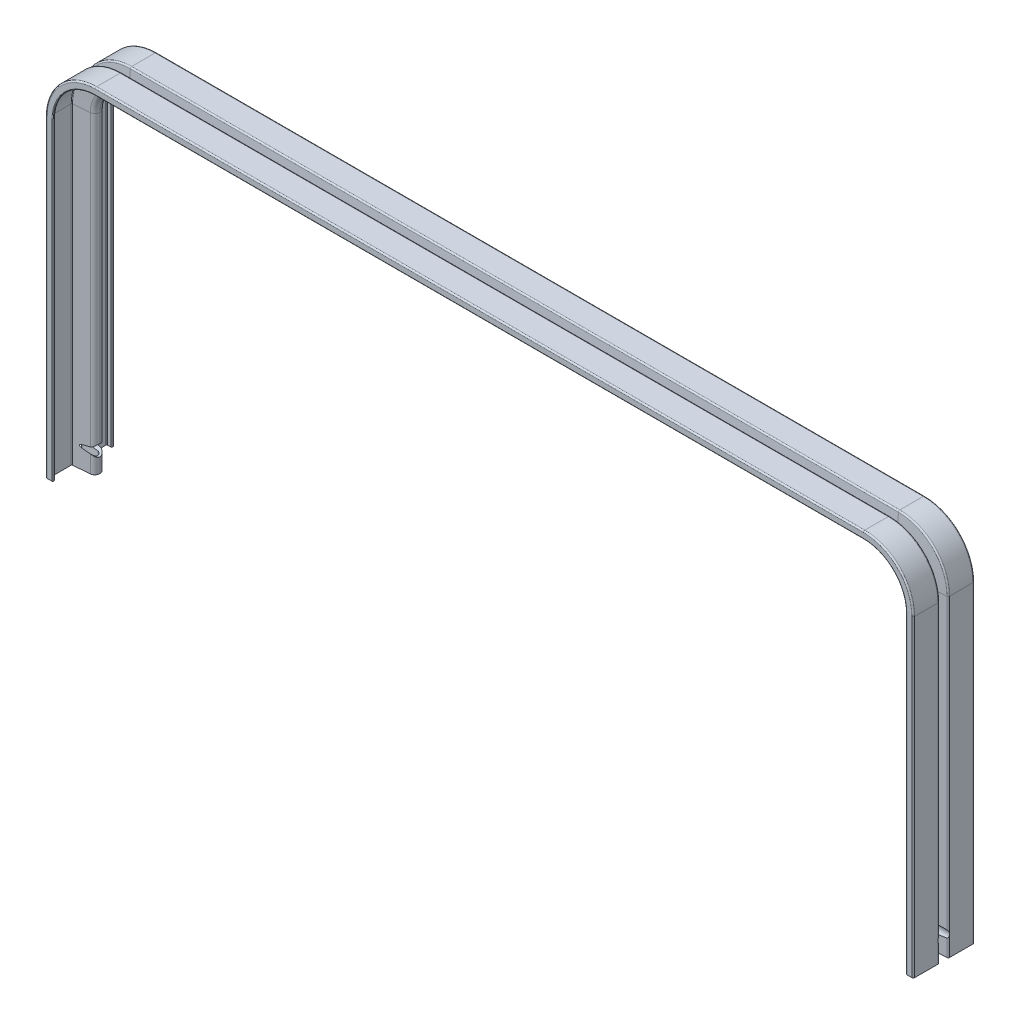
from build123d import *

# Parameters (mm, degrees)
SALIENTE_EXTRUIR1_DEPTH = 270
REVOLUCI_N1_ANGLE       = 90
SALIENTE_EXTRUIR2_DEPTH = 220
CROQUIS11_R             = 4.05
CORTAR_EXTRUIR1_DEPTH   = 657.513214965


with BuildPart() as part:
    # Croquis2 → Saliente-Extruir1 (new, symmetric)
    with BuildSketch(Plane(origin=(0, 0, 0), x_dir=(0, 0, -1), z_dir=(1, 0, 0))):
        with BuildLine():
            Line((-2.995207656, 11), (-3.004777082, 11.119617833))
            Line((-3.004777082, 11.119617833), (-3.100877661, 12.32087507))
            ThreePointArc((-3.100877661, 12.32087507), (-3.419366036, 12.975890088), (-4.09769294, 13.241129848))
            Line((-4.09769294, 13.241129848), (-5.827781501, 13.241129848))
            Line((-5.827781501, 13.241129848), (-20.5, 13.241129848))
            ThreePointArc((-20.5, 13.241129848), (-21.207106781, 12.948236629), (-21.5, 12.241129848))
            Line((-21.5, 12.241129848), (-21.5, 8.741129848))
            ThreePointArc((-21.5, 8.741129848), (-21.353553391, 8.387576457), (-21, 8.241129848))
            Line((-21, 8.241129848), (-20.5, 8.241129848))
            ThreePointArc((-20.5, 8.241129848), (-20.146446609, 8.387576457), (-20, 8.741129848))
            Line((-20, 8.741129848), (-20, 11.241129848))
            ThreePointArc((-20, 11.241129848), (-19.853553391, 11.594683238), (-19.5, 11.741129848))
            Line((-19.5, 11.741129848), (-5.827781501, 11.741129848))
            Line((-5.827781501, 11.741129848), (-5.020887836, 11.741129848))
            ThreePointArc((-5.020887836, 11.741129848), (-4.681724384, 11.608509968), (-4.522480197, 11.281002459))
            Line((-4.522480197, 11.281002459), (-4.5, 11))
            Line((-4.5, 11), (-3.597671338, -0.279108278))
            ThreePointArc((-3.597671338, -0.279108278), (-2.482962027, -2.571660842), (-0.108817863, -3.5))
            Line((-0.108817863, -3.5), (0.108817863, -3.5))
            ThreePointArc((0.108817863, -3.5), (2.482962027, -2.571660842), (3.597671338, -0.279108278))
            Line((3.597671338, -0.279108278), (4.5, 11))
            Line((4.5, 11), (4.522480197, 11.281002459))
            ThreePointArc((4.522480197, 11.281002459), (4.681724384, 11.608509968), (5.020887836, 11.741129848))
            Line((5.020887836, 11.741129848), (5.827781501, 11.741129848))
            Line((5.827781501, 11.741129848), (19.5, 11.741129848))
            ThreePointArc((19.5, 11.741129848), (19.853553391, 11.594683238), (20, 11.241129848))
            Line((20, 11.241129848), (20, 8.741129848))
            ThreePointArc((20, 8.741129848), (20.146446609, 8.387576457), (20.5, 8.241129848))
            Line((20.5, 8.241129848), (21, 8.241129848))
            ThreePointArc((21, 8.241129848), (21.353553391, 8.387576457), (21.5, 8.741129848))
            Line((21.5, 8.741129848), (21.5, 12.241129848))
            ThreePointArc((21.5, 12.241129848), (21.207106781, 12.948236629), (20.5, 13.241129848))
            Line((20.5, 13.241129848), (5.827781501, 13.241129848))
            Line((5.827781501, 13.241129848), (4.09769294, 13.241129848))
            ThreePointArc((4.09769294, 13.241129848), (3.419366036, 12.975890088), (3.100877661, 12.32087507))
            Line((3.100877661, 12.32087507), (3.004777082, 11.119617833))
            Line((3.004777082, 11.119617833), (2.995207656, 11))
            Line((2.995207656, 11), (2.10244842, -0.159490445))
            ThreePointArc((2.10244842, -0.159490445), (1.465471671, -1.469520481), (0.108817863, -2))
            Line((0.108817863, -2), (-0.108817863, -2))
            ThreePointArc((-0.108817863, -2), (-1.465471671, -1.469520481), (-2.10244842, -0.159490445))
            Line((-2.10244842, -0.159490445), (-2.995207656, 11))
        make_face()
    extrude(amount=SALIENTE_EXTRUIR1_DEPTH, both=True)

    # Croquis9 → Revolución1 (revolve)
    with BuildSketch(Plane(origin=(270, 0, 0), x_dir=(0, 0, -1), z_dir=(1, 0, 0))):
        with BuildLine():
            Line((-19.5, 11.741129848), (-5.020887836, 11.741129848))
            ThreePointArc((-5.020887836, 11.741129848), (-4.681724384, 11.608509968), (-4.522480197, 11.281002459))
            Line((-4.522480197, 11.281002459), (-3.597671338, -0.279108278))
            ThreePointArc((-3.597671338, -0.279108278), (-2.482962027, -2.571660842), (-0.108817863, -3.5))
            Line((-0.108817863, -3.5), (0.108817863, -3.5))
            ThreePointArc((0.108817863, -3.5), (2.482962027, -2.571660842), (3.597671338, -0.279108278))
            Line((3.597671338, -0.279108278), (4.522480197, 11.281002459))
            ThreePointArc((4.522480197, 11.281002459), (4.681724384, 11.608509968), (5.020887836, 11.741129848))
            Line((5.020887836, 11.741129848), (19.5, 11.741129848))
            ThreePointArc((19.5, 11.741129848), (19.853553391, 11.594683238), (20, 11.241129848))
            Line((20, 11.241129848), (20, 8.741129848))
            ThreePointArc((20, 8.741129848), (20.146446609, 8.387576457), (20.5, 8.241129848))
            Line((20.5, 8.241129848), (21, 8.241129848))
            ThreePointArc((21, 8.241129848), (21.353553391, 8.387576457), (21.5, 8.741129848))
            Line((21.5, 8.741129848), (21.5, 12.241129848))
            ThreePointArc((21.5, 12.241129848), (21.207106781, 12.948236629), (20.5, 13.241129848))
            Line((20.5, 13.241129848), (4.09769294, 13.241129848))
            ThreePointArc((4.09769294, 13.241129848), (3.419366036, 12.975890088), (3.100877661, 12.32087507))
            Line((3.100877661, 12.32087507), (2.10244842, -0.159490445))
            ThreePointArc((2.10244842, -0.159490445), (1.465471671, -1.469520481), (0.108817863, -2))
            Line((0.108817863, -2), (-0.108817863, -2))
            ThreePointArc((-0.108817863, -2), (-1.465471671, -1.469520481), (-2.10244842, -0.159490445))
            Line((-2.10244842, -0.159490445), (-3.100877661, 12.32087507))
            ThreePointArc((-3.100877661, 12.32087507), (-3.419366036, 12.975890088), (-4.09769294, 13.241129848))
            Line((-4.09769294, 13.241129848), (-20.5, 13.241129848))
            ThreePointArc((-20.5, 13.241129848), (-21.207106781, 12.948236629), (-21.5, 12.241129848))
            Line((-21.5, 12.241129848), (-21.5, 8.741129848))
            ThreePointArc((-21.5, 8.741129848), (-21.353553391, 8.387576457), (-21, 8.241129848))
            Line((-21, 8.241129848), (-20.5, 8.241129848))
            ThreePointArc((-20.5, 8.241129848), (-20.146446609, 8.387576457), (-20, 8.741129848))
            Line((-20, 8.741129848), (-20, 11.241129848))
            ThreePointArc((-20, 11.241129848), (-19.853553391, 11.594683238), (-19.5, 11.741129848))
        make_face()
    revoluci_n1 = revolve(axis=Axis((270, -21.758870152, 0.108817863), (0, 0, -1)), revolution_arc=REVOLUCI_N1_ANGLE)

    # Simetría1: Revolución1 across plane
    add(revoluci_n1.mirror(Plane(origin=(0, 0, 0), x_dir=(0, 0, 1), z_dir=(1, 0, 0))))

    # Croquis10 → Saliente-Extruir2 (add)
    with BuildSketch(Plane.XZ.offset(21.758870152)):
        with BuildLine():
            Line((300.5, 21.5), (304, 21.5))
            ThreePointArc((304, 21.5), (304.707106781, 21.207106781), (305, 20.5))
            Line((305, 20.5), (305, 4.09769294))
            ThreePointArc((305, 4.09769294), (304.734760241, 3.419366036), (304.079745222, 3.100877661))
            Line((304.079745222, 3.100877661), (291.599379708, 2.10244842))
            ThreePointArc((291.599379708, 2.10244842), (290.289349671, 1.465471671), (289.758870152, 0.108817863))
            Line((289.758870152, 0.108817863), (289.758870152, -0.108817863))
            ThreePointArc((289.758870152, -0.108817863), (290.289349671, -1.465471671), (291.599379708, -2.10244842))
            Line((291.599379708, -2.10244842), (304.079745222, -3.100877661))
            ThreePointArc((304.079745222, -3.100877661), (304.734760241, -3.419366036), (305, -4.09769294))
            Line((305, -4.09769294), (305, -20.5))
            ThreePointArc((305, -20.5), (304.707106781, -21.207106781), (304, -21.5))
            Line((304, -21.5), (300.5, -21.5))
            ThreePointArc((300.5, -21.5), (300.146446609, -21.353553391), (300, -21))
            Line((300, -21), (300, -20.5))
            ThreePointArc((300, -20.5), (300.146446609, -20.146446609), (300.5, -20))
            Line((300.5, -20), (303, -20))
            ThreePointArc((303, -20), (303.353553391, -19.853553391), (303.5, -19.5))
            Line((303.5, -19.5), (303.5, -5.020887836))
            ThreePointArc((303.5, -5.020887836), (303.36738012, -4.681724384), (303.039872611, -4.522480197))
            Line((303.039872611, -4.522480197), (291.479761874, -3.597671338))
            ThreePointArc((291.479761874, -3.597671338), (289.18720931, -2.482962027), (288.258870152, -0.108817863))
            Line((288.258870152, -0.108817863), (288.258870152, 0.108817863))
            ThreePointArc((288.258870152, 0.108817863), (289.18720931, 2.482962027), (291.479761874, 3.597671338))
            Line((291.479761874, 3.597671338), (303.039872611, 4.522480197))
            ThreePointArc((303.039872611, 4.522480197), (303.36738012, 4.681724384), (303.5, 5.020887836))
            Line((303.5, 5.020887836), (303.5, 19.5))
            ThreePointArc((303.5, 19.5), (303.353553391, 19.853553391), (303, 20))
            Line((303, 20), (300.5, 20))
            ThreePointArc((300.5, 20), (300.146446609, 20.146446609), (300, 20.5))
            Line((300, 20.5), (300, 21))
            ThreePointArc((300, 21), (300.146446609, 21.353553391), (300.5, 21.5))
        make_face()
    saliente_extruir2 = extrude(amount=SALIENTE_EXTRUIR2_DEPTH)

    # Simetría2: Saliente-Extruir2 across plane
    add(saliente_extruir2.mirror(Plane(origin=(0, 0, 0), x_dir=(0, 0, 1), z_dir=(1, 0, 0))))

    # Croquis11 → Cortar-Extruir1 (cut, through all)
    with BuildSketch(Plane.ZY.offset(305)):
        with Locations((0.108817863, -227.429441325)):
            Circle(CROQUIS11_R)
    extrude(amount=-CORTAR_EXTRUIR1_DEPTH, mode=Mode.SUBTRACT)


solid = part.part
